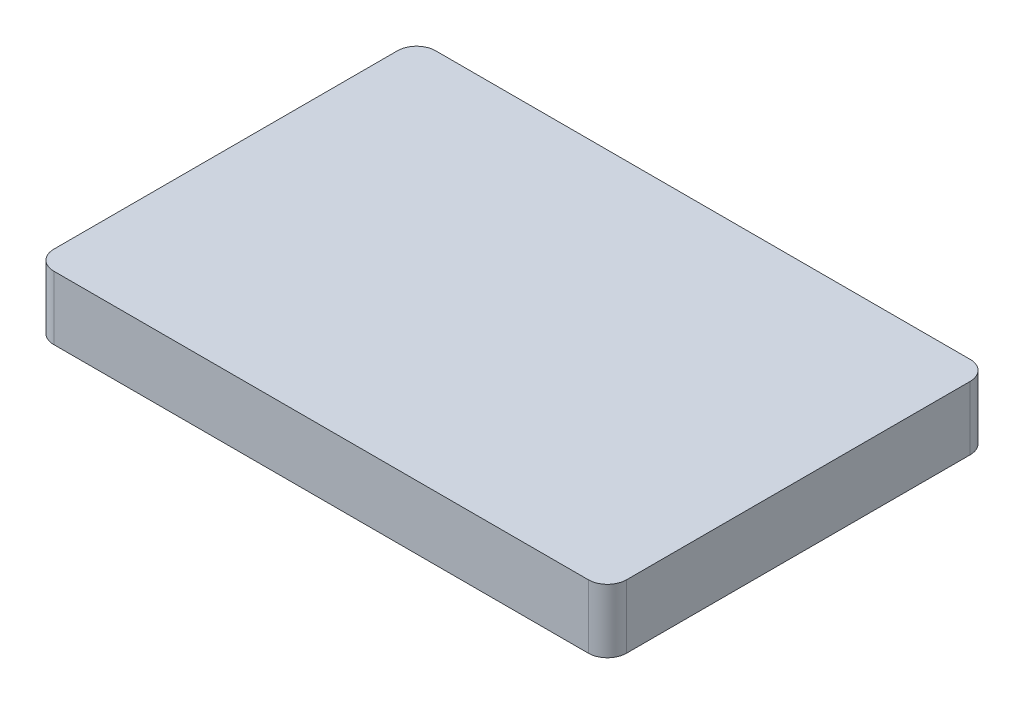
from build123d import *

# Parameters (mm, degrees)
SKETCH_1_W      = 90
SKETCH_1_H      = 60
EXTRUDE_1_DEPTH = 10
FILLET_1_R      = 3


with BuildPart() as part:
    # 草图1 → 凸台-拉伸1 (new body)
    with BuildSketch(Plane(origin=(0, 0, 0), x_dir=(1, 0, 0), z_dir=(0, 1, 0))):
        Rectangle(SKETCH_1_W, SKETCH_1_H)
    extrude(amount=EXTRUDE_1_DEPTH)

    # 圆角1
    fillet_1_edges = [part.edges().sort_by_distance(p)[0] for p in [
        (-45, 5, -30),
        (45, 5, -30),
        (45, 5, 30),
        (-45, 5, 30),
    ]]
    fillet(fillet_1_edges, radius=FILLET_1_R)


solid = part.part
